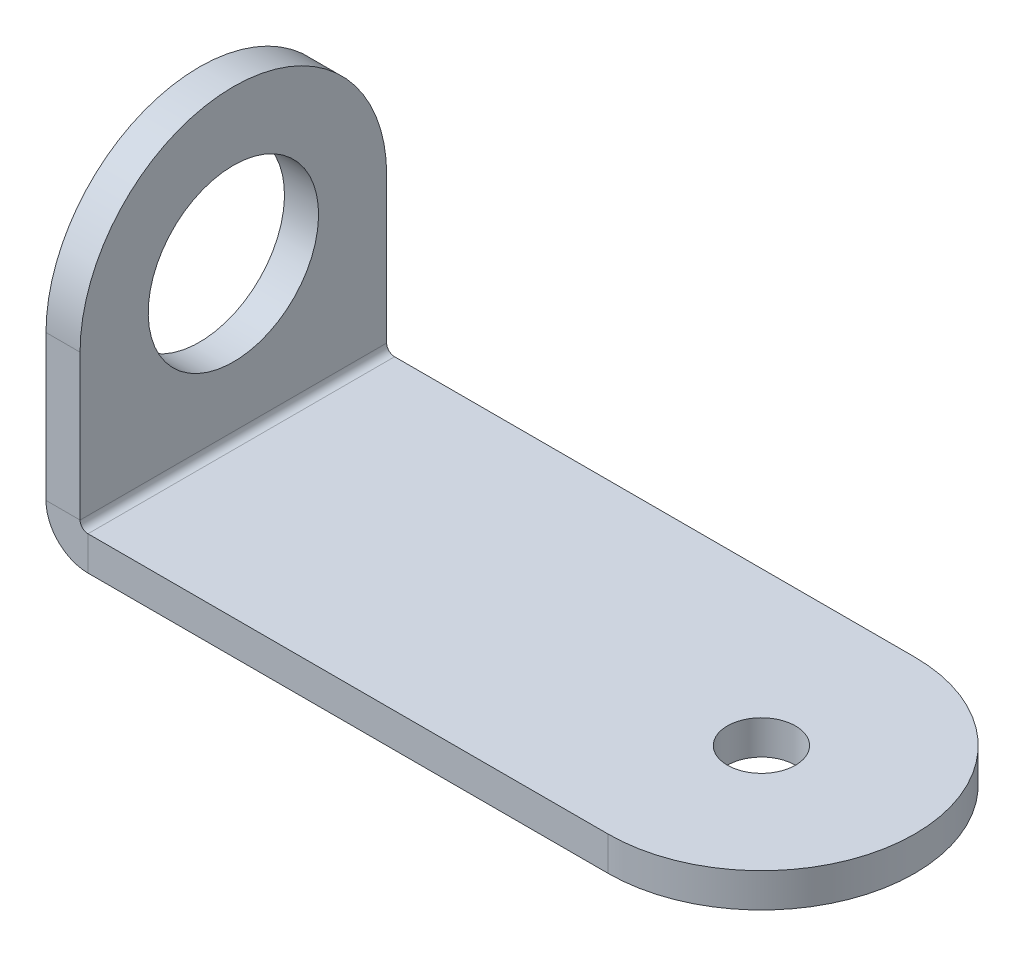
from build123d import *

# Parameters (mm, degrees)
BASE_FLANGE1_DEPTH = 14.2875
SKETCH8_R          = 7.9375
CUT_EXTRUDE3_DEPTH = 72.083846838
SKETCH7_R          = 3.175
CUT_EXTRUDE2_DEPTH = 72.083846838
FILLET1_RADIUS     = 14.2875
FILLET1_LENGTH     = 3.175
FILLET2_RADIUS     = 14.2875
FILLET2_LENGTH     = 3.175


# Sheet-metal steps are written as plain solids
with BuildPart() as part:
    # Sketch1 → Base-Flange1 (new, symmetric)
    with BuildSketch(Plane.XY):
        with BuildLine():
            Line((0, 28.575), (0, 0.7366))
            ThreePointArc((0, 0.7366), (0.215745145, 0.215745145), (0.7366, 0))
            Line((0.7366, 0), (63.5, 0))
            Line((63.5, 0), (63.5, -3.175))
            Line((63.5, -3.175), (0.7366, -3.175))
            ThreePointArc((0.7366, -3.175), (-2.029318885, -2.029318885), (-3.175, 0.7366))
            Line((-3.175, 0.7366), (-3.175, 28.575))
            Line((-3.175, 28.575), (0, 28.575))
        make_face()
    extrude(amount=BASE_FLANGE1_DEPTH, both=True)

    # Sketch8 → Cut-Extrude3 (cut, through all)
    with BuildSketch(Plane(origin=(0, 0, 0), x_dir=(0, 0, -1), z_dir=(1, 0, 0))):
        with Locations(Location((0, 14.2875, 0), (0, 0, 90))):
            Circle(SKETCH8_R)
    extrude(amount=-CUT_EXTRUDE3_DEPTH, mode=Mode.SUBTRACT)

    # Sketch7 → Cut-Extrude2 (cut, through all)
    with BuildSketch(Plane(origin=(0, 0, 0), x_dir=(1, 0, 0), z_dir=(0, 1, 0))):
        with Locations(Location((49.2125, 0, 0), (0, 0, 270))):
            Circle(SKETCH7_R)
    extrude(amount=-CUT_EXTRUDE2_DEPTH, mode=Mode.SUBTRACT)

    # Fillet1: full round fillet: the end face becomes a half cylinder, R = half its width
    fillet1_face = Plane((63.5, -1.5875, 0), x_dir=(0, -1, 0), z_dir=(1, 0, 0))  # on the end face: x along it, z out of the body
    fillet1_slab = fillet1_face.offset(-FILLET1_RADIUS / 2) * Box(FILLET1_LENGTH, 2 * FILLET1_RADIUS, FILLET1_RADIUS, mode=Mode.PRIVATE)  # the body's end, R deep
    fillet1_round = Plane((49.2125, -1.5875, 0), x_dir=(1, 0, 0), z_dir=(0, -1, 0)) * Cylinder(FILLET1_RADIUS, FILLET1_LENGTH, mode=Mode.PRIVATE)  # its axis R under the face
    add(fillet1_slab - fillet1_round, mode=Mode.SUBTRACT)

    # Fillet2: full round fillet: the end face becomes a half cylinder, R = half its width
    fillet2_face = Plane((-1.5875, 28.575, 0), x_dir=(1, 0, 0), z_dir=(0, 1, 0))  # on the end face: x along it, z out of the body
    fillet2_slab = fillet2_face.offset(-FILLET2_RADIUS / 2) * Box(FILLET2_LENGTH, 2 * FILLET2_RADIUS, FILLET2_RADIUS, mode=Mode.PRIVATE)  # the body's end, R deep
    fillet2_round = Plane((-1.5875, 14.2875, 0), x_dir=(0, 1, 0), z_dir=(1, 0, 0)) * Cylinder(FILLET2_RADIUS, FILLET2_LENGTH, mode=Mode.PRIVATE)  # its axis R under the face
    add(fillet2_slab - fillet2_round, mode=Mode.SUBTRACT)


solid = part.part
